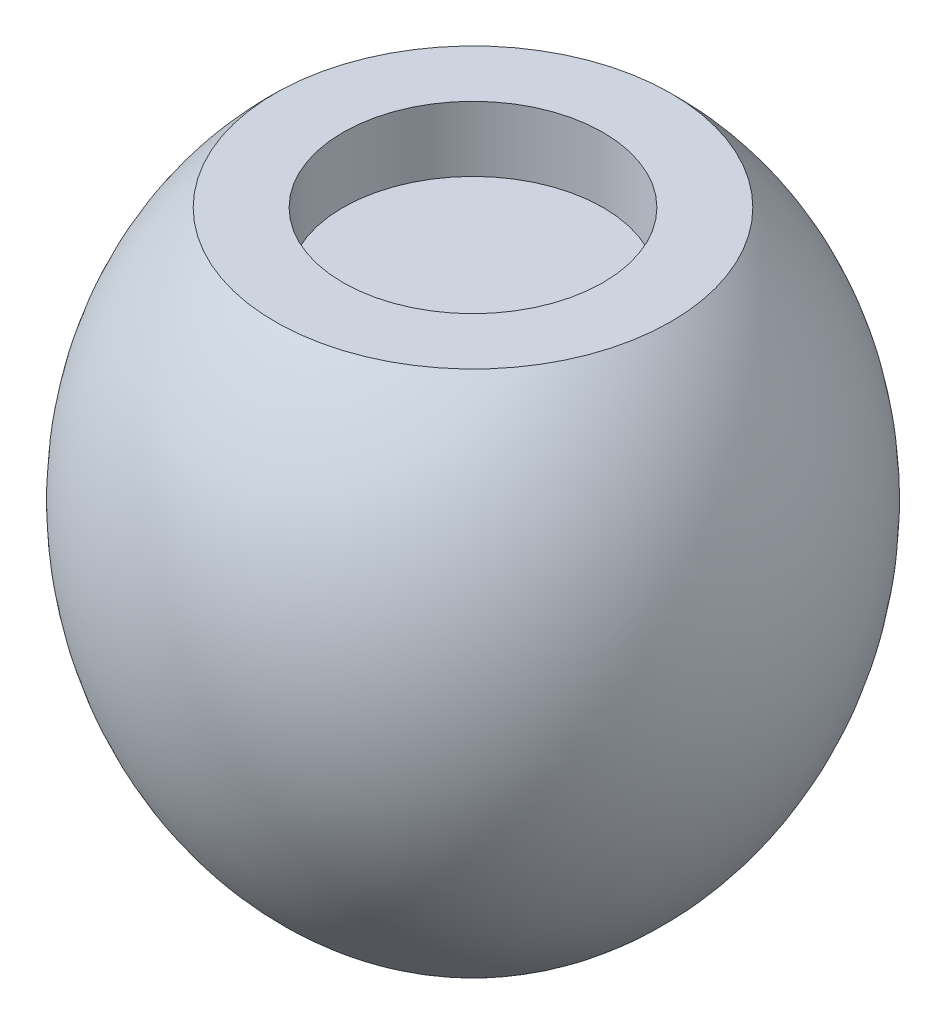
from build123d import *

# Parameters (mm, degrees)
HOLE1_START     = 250.913563574
HOLE1_OUTLINE_R = 60
HOLE1_DEPTH     = 30


# Read off the part's stored shape, not the designer's step: Hole1
with BuildPart() as part:
    # Sketch1 → Revolve6 (revolve)
    with BuildSketch(Plane.XY):
        with BuildLine():
            Line((91.274349755, 280.913563574), (-9e-09, 280.913563574))
            Line((-9e-09, 280.913563574), (-9e-09, 3e-09))
            add(Edge.make_bspline(
                [(-9e-09, 3e-09), (0.091989573, -0.030214934), (0.27698516, -0.087252105), (0.651025601, -0.187798967), (1.122698198, -0.296732641), (1.786879755, -0.431368155), (2.74162502, -0.592094226), (3.89368651, -0.743441748), (5.38289706, -0.878736697), (7.015713919, -0.964240306), (8.693411621, -0.993855838), (10.414072424, -0.969044452), (12.940843472, -0.858456297), (16.266634453, -0.565795726), (20.450134204, 0.029521011), (25.457220295, 1.057074726), (30.473634045, 2.382349251), (35.48761579, 3.99074212), (40.417625987, 5.839687063), (45.258322203, 7.910730255), (51.92885298, 11.111137534), (61.835118969, 16.660715938), (74.42185706, 25.41064177), (88.802372855, 38.275070049), (102.610809616, 54.239411195), (114.380492331, 71.755843119), (124.012069939, 90.530465597), (130.488447554, 107.819733576), (134.592531576, 123.088241118), (137.023436311, 136.027627029), (138.365467236, 146.474444179), (139.096219756, 156.981823991), (139.207889835, 167.514102999), (138.693565855, 178.03455236), (137.547432357, 188.505187398), (135.764966432, 198.886644329), (133.343198251, 209.138052599), (130.280993263, 219.216953733), (126.579382252, 229.079252777), (122.784110511, 237.479223572), (119.441545144, 243.901810038), (116.829197832, 248.471805701), (115.132149087, 251.290070823), (113.736126906, 253.521102102), (112.301898629, 255.727808503), (110.829765163, 257.909339257), (109.319853588, 260.06502184), (107.772630663, 262.193872297), (106.188040412, 264.295420016), (104.566957609, 266.368319849), (103.115952966, 268.1572067), (101.850548572, 269.67095486), (100.779582665, 270.921128036), (99.916536979, 271.910996123), (99.039208527, 272.898191984), (98.162610179, 273.868316914), (97.261043818, 274.84587273), (96.377456465, 275.789772177), (95.442898163, 276.765771152), (94.566159997, 277.669921291), (93.583951565, 278.658249353), (92.747743102, 279.490480582), (91.92353091, 280.290495929), (91.489785056, 280.707715472), (91.274349755, 280.913563574)],
                knots=[0, 0, 0, 0, 0, 0.000955617, 0.001911234, 0.003822469, 0.004778086, 0.007644938, 0.011467406, 0.015289875, 0.019536269, 0.023782662, 0.028029055, 0.032275449, 0.044501001, 0.056726554, 0.069716783, 0.082707012, 0.095697084, 0.108687156, 0.121677228, 0.1346673, 0.168714413, 0.220674482, 0.272634491, 0.324594549, 0.376554581, 0.428514578, 0.480474526, 0.506454549, 0.532434572, 0.558414577, 0.584394583, 0.610374589, 0.636354595, 0.662334599, 0.688314604, 0.71429461, 0.740274617, 0.766254618, 0.792234618, 0.805224618, 0.811719617, 0.818214617, 0.824709616, 0.831204616, 0.837699615, 0.844194615, 0.850689614, 0.857184613, 0.863679612, 0.870174612, 0.873422111, 0.876669611, 0.87991711, 0.88316461, 0.886412109, 0.889659609, 0.892907109, 0.896154608, 0.899390298, 0.902625988, 0.905861678, 0.909097368, 0.909097368, 0.909097368, 0.909097368, 0.909097368], degree=4))
        make_face()
    revolve(axis=Axis((-9e-09, 3e-09, 0), (0, 1, 0)))

    # Hole1 outline → Hole1 (cut)
    with BuildSketch(Plane(origin=(0, 0, 0), x_dir=(1, 0, 0), z_dir=(0, 1, 0)).offset(HOLE1_START)):
        Circle(HOLE1_OUTLINE_R)
    extrude(amount=HOLE1_DEPTH, mode=Mode.SUBTRACT)


solid = part.part
